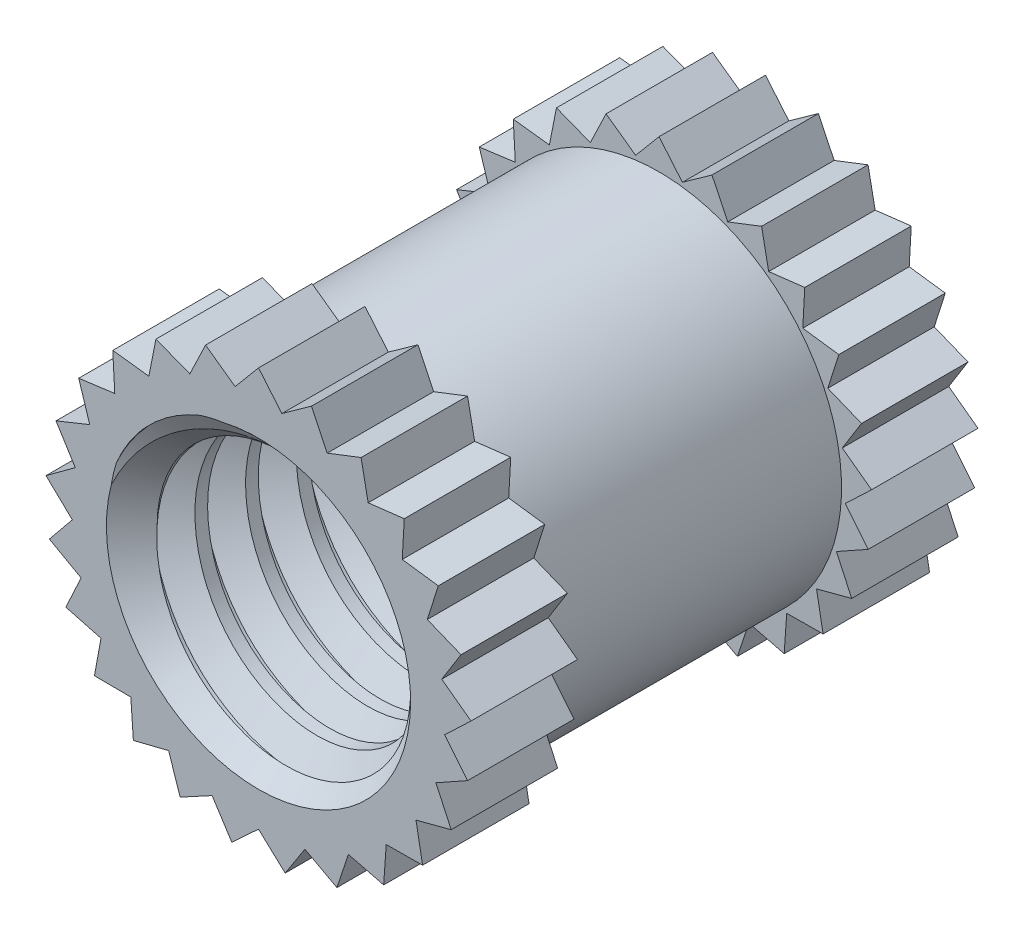
from build123d import *

# Parameters (mm, degrees)
SKETCH1_R             = 1.8
BOSS_EXTRUDE1_DEPTH   = 2.5
THREAD1_PITCH         = 0.5
BOSS_EXTRUDE2_DEPTH   = 1.05
CIRPATTERN1_COUNT     = 25
MIRROR1_COPY_1_DEPTH  = 1.05
MIRROR1_COPY_2_DEPTH  = 1.05
MIRROR1_COPY_3_DEPTH  = 1.05
MIRROR1_COPY_4_DEPTH  = 1.05
MIRROR1_COPY_5_DEPTH  = 1.05
MIRROR1_COPY_6_DEPTH  = 1.05
MIRROR1_COPY_7_DEPTH  = 1.05
MIRROR1_COPY_8_DEPTH  = 1.05
MIRROR1_COPY_9_DEPTH  = 1.05
MIRROR1_COPY_10_DEPTH = 1.05
MIRROR1_COPY_11_DEPTH = 1.05
MIRROR1_COPY_12_DEPTH = 1.05
MIRROR1_COPY_13_DEPTH = 1.05
MIRROR1_COPY_14_DEPTH = 1.05
MIRROR1_COPY_15_DEPTH = 1.05
MIRROR1_COPY_16_DEPTH = 1.05
MIRROR1_COPY_17_DEPTH = 1.05
MIRROR1_COPY_18_DEPTH = 1.05
MIRROR1_COPY_19_DEPTH = 1.05
MIRROR1_COPY_20_DEPTH = 1.05
MIRROR1_COPY_21_DEPTH = 1.05
MIRROR1_COPY_22_DEPTH = 1.05
MIRROR1_COPY_23_DEPTH = 1.05
MIRROR1_COPY_24_DEPTH = 1.05


with BuildPart() as part:
    # Sketch1 → Boss-Extrude1 (new, symmetric)
    with BuildSketch(Plane.XY):
        Circle(SKETCH1_R)
    extrude(amount=BOSS_EXTRUDE1_DEPTH, both=True)

    # Sketch3 → Tap Drill for M3x0.5 Tap1 (revolve, cut)
    with BuildSketch(Plane(origin=(0, 0, 2.5), x_dir=(0, -1, 0), z_dir=(1, 0, 0))):
        Polygon((0, 0), (0, 5), (1.5, 5), (1.25, 4.75), (1.25, 0.25), (1.5, 0), align=None)
    revolve(axis=Axis((0, 0, 8.85), (0, 0, -1)), mode=Mode.SUBTRACT)

    # Thread1: the profile of Thread Profile1 profile screwed along a right-hand helix of 16 turns, 6 arcs to a turn; built about Z, then put on its axis
    thread1_z = Axis((0, 0, 0), (0, 0, 1))
    thread1_corners = [(1.2497, 0, -0.000173205), (1.520632937, 0, 0.156249999), (1.520632937, 0, 0.218749999), (1.2497, 0, 0.375173204)]
    with BuildLine(mode=Mode.PRIVATE) as thread1_profile:
        Line(thread1_corners[0], thread1_corners[1])
        Line(thread1_corners[1], thread1_corners[2])
        Line(thread1_corners[2], thread1_corners[3])
        Line(thread1_corners[3], thread1_corners[0])
    thread1_cap = Face(thread1_profile.wire())
    thread1_turn_angles = [0, 30, 60, 90, 120, 150, 180, 210, 240, 270, 300, 330, 360]
    thread1_turn_weights = [1, 0.8660254037844387, 1, 0.8660254037844387, 1, 0.8660254037844387, 1, 0.8660254037844387, 1, 0.8660254037844387, 1, 0.8660254037844387, 1]
    thread1_turn_rails = [Edge.make_bspline([Vector(p[0], p[1], 0).rotate(thread1_z, thread1_turn_angles[k]) / thread1_turn_weights[k] + Vector(0, 0, p[2] + THREAD1_PITCH * thread1_turn_angles[k] / 360) for k in range(13)], [0, 0, 0, 1, 1, 2, 2, 3, 3, 4, 4, 5, 5, 6, 6, 6], 2, thread1_turn_weights) for p in thread1_corners]
    thread1_turn_sides = [Face.make_surface_from_curves(thread1_turn_rails[p[0]], thread1_turn_rails[p[1]]) for p in [(0, 1), (1, 2), (2, 3), (3, 0)]]
    thread1 = Plane(origin=(0, 0, 3.25), x_dir=(-1, 0, 0), z_dir=(0, 0, -1)) * Solid(Shell([*[p.moved(Location((0, 0, THREAD1_PITCH * i))) for i in range(16) for p in thread1_turn_sides], thread1_cap, thread1_cap.rotate(thread1_z, 5760).moved(Location((0, 0, THREAD1_PITCH * 5760 / 360)))]))
    add(thread1, mode=Mode.SUBTRACT)

    # Sketch6 → Boss-Extrude2 (add)
    with BuildSketch(Plane.XY.offset(2.5)):
        with BuildLine():
            Line((0, 2.1), (-0.268646455, 1.779839623))
            ThreePointArc((-0.268646455, 1.779839623), (0, 1.8), (0.268646455, 1.779839623))
            Line((0.268646455, 1.779839623), (0, 2.1))
        make_face()
    boss_extrude2 = extrude(amount=-BOSS_EXTRUDE2_DEPTH)

    # CirPattern1: Boss-Extrude2 ×25 about axis
    cirpattern1_axis = Axis((0, 0, 0), (0, 0, 1))
    for i in range(1, CIRPATTERN1_COUNT):
        add(boss_extrude2.rotate(cirpattern1_axis, i * 360 / CIRPATTERN1_COUNT))

    # Mirror1: Boss-Extrude2 across plane
    add(boss_extrude2.mirror(Plane.XY))

    # Mirror1 copy 1 sketch → Mirror1 copy 1 (add)
    with BuildSketch(Plane(origin=(0, 0, -2.5), x_dir=(0.9685831611286311, 0.2486898871648548, 0), z_dir=(0, 0, -1))):
        with BuildLine():
            Line((0, -2.1), (-0.268646455, -1.779839623))
            ThreePointArc((-0.268646455, -1.779839623), (0, -1.8), (0.268646455, -1.779839623))
            Line((0.268646455, -1.779839623), (0, -2.1))
        make_face()
    extrude(amount=-MIRROR1_COPY_1_DEPTH)

    # Mirror1 copy 2 sketch → Mirror1 copy 2 (add)
    with BuildSketch(Plane(origin=(0, 0, -2.5), x_dir=(0.8763066800438636, 0.4817536741017153, 0), z_dir=(0, 0, -1))):
        with BuildLine():
            Line((0, -2.1), (-0.268646455, -1.779839623))
            ThreePointArc((-0.268646455, -1.779839623), (0, -1.8), (0.268646455, -1.779839623))
            Line((0.268646455, -1.779839623), (0, -2.1))
        make_face()
    extrude(amount=-MIRROR1_COPY_2_DEPTH)

    # Mirror1 copy 3 sketch → Mirror1 copy 3 (add)
    with BuildSketch(Plane(origin=(0, 0, -2.5), x_dir=(0.7289686274214116, 0.6845471059286887, 0), z_dir=(0, 0, -1))):
        with BuildLine():
            Line((0, -2.1), (-0.268646455, -1.779839623))
            ThreePointArc((-0.268646455, -1.779839623), (0, -1.8), (0.268646455, -1.779839623))
            Line((0.268646455, -1.779839623), (0, -2.1))
        make_face()
    extrude(amount=-MIRROR1_COPY_3_DEPTH)

    # Mirror1 copy 4 sketch → Mirror1 copy 4 (add)
    with BuildSketch(Plane(origin=(0, 0, -2.5), x_dir=(0.5358267949789965, 0.8443279255020151, 0), z_dir=(0, 0, -1))):
        with BuildLine():
            Line((0, -2.1), (-0.268646455, -1.779839623))
            ThreePointArc((-0.268646455, -1.779839623), (0, -1.8), (0.268646455, -1.779839623))
            Line((0.268646455, -1.779839623), (0, -2.1))
        make_face()
    extrude(amount=-MIRROR1_COPY_4_DEPTH)

    # Mirror1 copy 5 sketch → Mirror1 copy 5 (add)
    with BuildSketch(Plane(origin=(0, 0, -2.5), x_dir=(0.30901699437494745, 0.9510565162951535, 0), z_dir=(0, 0, -1))):
        with BuildLine():
            Line((0, -2.1), (-0.268646455, -1.779839623))
            ThreePointArc((-0.268646455, -1.779839623), (0, -1.8), (0.268646455, -1.779839623))
            Line((0.268646455, -1.779839623), (0, -2.1))
        make_face()
    extrude(amount=-MIRROR1_COPY_5_DEPTH)

    # Mirror1 copy 6 sketch → Mirror1 copy 6 (add)
    with BuildSketch(Plane(origin=(0, 0, -2.5), x_dir=(0.0627905195293133, 0.9980267284282716, 0), z_dir=(0, 0, -1))):
        with BuildLine():
            Line((0, -2.1), (-0.268646455, -1.779839623))
            ThreePointArc((-0.268646455, -1.779839623), (0, -1.8), (0.268646455, -1.779839623))
            Line((0.268646455, -1.779839623), (0, -2.1))
        make_face()
    extrude(amount=-MIRROR1_COPY_6_DEPTH)

    # Mirror1 copy 7 sketch → Mirror1 copy 7 (add)
    with BuildSketch(Plane(origin=(0, 0, -2.5), x_dir=(-0.1873813145857246, 0.9822872507286887, 0), z_dir=(0, 0, -1))):
        with BuildLine():
            Line((0, -2.1), (-0.268646455, -1.779839623))
            ThreePointArc((-0.268646455, -1.779839623), (0, -1.8), (0.268646455, -1.779839623))
            Line((0.268646455, -1.779839623), (0, -2.1))
        make_face()
    extrude(amount=-MIRROR1_COPY_7_DEPTH)

    # Mirror1 copy 8 sketch → Mirror1 copy 8 (add)
    with BuildSketch(Plane(origin=(0, 0, -2.5), x_dir=(-0.4257792915650727, 0.9048270524660195, 0), z_dir=(0, 0, -1))):
        with BuildLine():
            Line((0, -2.1), (-0.268646455, -1.779839623))
            ThreePointArc((-0.268646455, -1.779839623), (0, -1.8), (0.268646455, -1.779839623))
            Line((0.268646455, -1.779839623), (0, -2.1))
        make_face()
    extrude(amount=-MIRROR1_COPY_8_DEPTH)

    # Mirror1 copy 9 sketch → Mirror1 copy 9 (add)
    with BuildSketch(Plane(origin=(0, 0, -2.5), x_dir=(-0.6374239897486897, 0.7705132427757893, 0), z_dir=(0, 0, -1))):
        with BuildLine():
            Line((0, -2.1), (-0.268646455, -1.779839623))
            ThreePointArc((-0.268646455, -1.779839623), (0, -1.8), (0.268646455, -1.779839623))
            Line((0.268646455, -1.779839623), (0, -2.1))
        make_face()
    extrude(amount=-MIRROR1_COPY_9_DEPTH)

    # Mirror1 copy 10 sketch → Mirror1 copy 10 (add)
    with BuildSketch(Plane(origin=(0, 0, -2.5), x_dir=(-0.8090169943749473, 0.5877852522924732, 0), z_dir=(0, 0, -1))):
        with BuildLine():
            Line((0, -2.1), (-0.268646455, -1.779839623))
            ThreePointArc((-0.268646455, -1.779839623), (0, -1.8), (0.268646455, -1.779839623))
            Line((0.268646455, -1.779839623), (0, -2.1))
        make_face()
    extrude(amount=-MIRROR1_COPY_10_DEPTH)

    # Mirror1 copy 11 sketch → Mirror1 copy 11 (add)
    with BuildSketch(Plane(origin=(0, 0, -2.5), x_dir=(-0.9297764858882515, 0.36812455268467775, 0), z_dir=(0, 0, -1))):
        with BuildLine():
            Line((0, -2.1), (-0.268646455, -1.779839623))
            ThreePointArc((-0.268646455, -1.779839623), (0, -1.8), (0.268646455, -1.779839623))
            Line((0.268646455, -1.779839623), (0, -2.1))
        make_face()
    extrude(amount=-MIRROR1_COPY_11_DEPTH)

    # Mirror1 copy 12 sketch → Mirror1 copy 12 (add)
    with BuildSketch(Plane(origin=(0, 0, -2.5), x_dir=(-0.9921147013144779, 0.1253332335643041, 0), z_dir=(0, 0, -1))):
        with BuildLine():
            Line((0, -2.1), (-0.268646455, -1.779839623))
            ThreePointArc((-0.268646455, -1.779839623), (0, -1.8), (0.268646455, -1.779839623))
            Line((0.268646455, -1.779839623), (0, -2.1))
        make_face()
    extrude(amount=-MIRROR1_COPY_12_DEPTH)

    # Mirror1 copy 13 sketch → Mirror1 copy 13 (add)
    with BuildSketch(Plane(origin=(0, 0, -2.5), x_dir=(-0.9921147013144779, -0.12533323356430429, 0), z_dir=(0, 0, -1))):
        with BuildLine():
            Line((0, -2.1), (-0.268646455, -1.779839623))
            ThreePointArc((-0.268646455, -1.779839623), (0, -1.8), (0.268646455, -1.779839623))
            Line((0.268646455, -1.779839623), (0, -2.1))
        make_face()
    extrude(amount=-MIRROR1_COPY_13_DEPTH)

    # Mirror1 copy 14 sketch → Mirror1 copy 14 (add)
    with BuildSketch(Plane(origin=(0, 0, -2.5), x_dir=(-0.9297764858882515, -0.3681245526846779, 0), z_dir=(0, 0, -1))):
        with BuildLine():
            Line((0, -2.1), (-0.268646455, -1.779839623))
            ThreePointArc((-0.268646455, -1.779839623), (0, -1.8), (0.268646455, -1.779839623))
            Line((0.268646455, -1.779839623), (0, -2.1))
        make_face()
    extrude(amount=-MIRROR1_COPY_14_DEPTH)

    # Mirror1 copy 15 sketch → Mirror1 copy 15 (add)
    with BuildSketch(Plane(origin=(0, 0, -2.5), x_dir=(-0.8090169943749476, -0.587785252292473, 0), z_dir=(0, 0, -1))):
        with BuildLine():
            Line((0, -2.1), (-0.268646455, -1.779839623))
            ThreePointArc((-0.268646455, -1.779839623), (0, -1.8), (0.268646455, -1.779839623))
            Line((0.268646455, -1.779839623), (0, -2.1))
        make_face()
    extrude(amount=-MIRROR1_COPY_15_DEPTH)

    # Mirror1 copy 16 sketch → Mirror1 copy 16 (add)
    with BuildSketch(Plane(origin=(0, 0, -2.5), x_dir=(-0.6374239897486895, -0.7705132427757894, 0), z_dir=(0, 0, -1))):
        with BuildLine():
            Line((0, -2.1), (-0.268646455, -1.779839623))
            ThreePointArc((-0.268646455, -1.779839623), (0, -1.8), (0.268646455, -1.779839623))
            Line((0.268646455, -1.779839623), (0, -2.1))
        make_face()
    extrude(amount=-MIRROR1_COPY_16_DEPTH)

    # Mirror1 copy 17 sketch → Mirror1 copy 17 (add)
    with BuildSketch(Plane(origin=(0, 0, -2.5), x_dir=(-0.42577929156507216, -0.9048270524660198, 0), z_dir=(0, 0, -1))):
        with BuildLine():
            Line((0, -2.1), (-0.268646455, -1.779839623))
            ThreePointArc((-0.268646455, -1.779839623), (0, -1.8), (0.268646455, -1.779839623))
            Line((0.268646455, -1.779839623), (0, -2.1))
        make_face()
    extrude(amount=-MIRROR1_COPY_17_DEPTH)

    # Mirror1 copy 18 sketch → Mirror1 copy 18 (add)
    with BuildSketch(Plane(origin=(0, 0, -2.5), x_dir=(-0.18738131458572463, -0.9822872507286887, 0), z_dir=(0, 0, -1))):
        with BuildLine():
            Line((0, -2.1), (-0.268646455, -1.779839623))
            ThreePointArc((-0.268646455, -1.779839623), (0, -1.8), (0.268646455, -1.779839623))
            Line((0.268646455, -1.779839623), (0, -2.1))
        make_face()
    extrude(amount=-MIRROR1_COPY_18_DEPTH)

    # Mirror1 copy 19 sketch → Mirror1 copy 19 (add)
    with BuildSketch(Plane(origin=(0, 0, -2.5), x_dir=(0.06279051952931372, -0.9980267284282716, 0), z_dir=(0, 0, -1))):
        with BuildLine():
            Line((0, -2.1), (-0.268646455, -1.779839623))
            ThreePointArc((-0.268646455, -1.779839623), (0, -1.8), (0.268646455, -1.779839623))
            Line((0.268646455, -1.779839623), (0, -2.1))
        make_face()
    extrude(amount=-MIRROR1_COPY_19_DEPTH)

    # Mirror1 copy 20 sketch → Mirror1 copy 20 (add)
    with BuildSketch(Plane(origin=(0, 0, -2.5), x_dir=(0.30901699437494723, -0.9510565162951536, 0), z_dir=(0, 0, -1))):
        with BuildLine():
            Line((0, -2.1), (-0.268646455, -1.779839623))
            ThreePointArc((-0.268646455, -1.779839623), (0, -1.8), (0.268646455, -1.779839623))
            Line((0.268646455, -1.779839623), (0, -2.1))
        make_face()
    extrude(amount=-MIRROR1_COPY_20_DEPTH)

    # Mirror1 copy 21 sketch → Mirror1 copy 21 (add)
    with BuildSketch(Plane(origin=(0, 0, -2.5), x_dir=(0.5358267949789968, -0.844327925502015, 0), z_dir=(0, 0, -1))):
        with BuildLine():
            Line((0, -2.1), (-0.268646455, -1.779839623))
            ThreePointArc((-0.268646455, -1.779839623), (0, -1.8), (0.268646455, -1.779839623))
            Line((0.268646455, -1.779839623), (0, -2.1))
        make_face()
    extrude(amount=-MIRROR1_COPY_21_DEPTH)

    # Mirror1 copy 22 sketch → Mirror1 copy 22 (add)
    with BuildSketch(Plane(origin=(0, 0, -2.5), x_dir=(0.7289686274214119, -0.6845471059286883, 0), z_dir=(0, 0, -1))):
        with BuildLine():
            Line((0, -2.1), (-0.268646455, -1.779839623))
            ThreePointArc((-0.268646455, -1.779839623), (0, -1.8), (0.268646455, -1.779839623))
            Line((0.268646455, -1.779839623), (0, -2.1))
        make_face()
    extrude(amount=-MIRROR1_COPY_22_DEPTH)

    # Mirror1 copy 23 sketch → Mirror1 copy 23 (add)
    with BuildSketch(Plane(origin=(0, 0, -2.5), x_dir=(0.8763066800438636, -0.4817536741017153, 0), z_dir=(0, 0, -1))):
        with BuildLine():
            Line((0, -2.1), (-0.268646455, -1.779839623))
            ThreePointArc((-0.268646455, -1.779839623), (0, -1.8), (0.268646455, -1.779839623))
            Line((0.268646455, -1.779839623), (0, -2.1))
        make_face()
    extrude(amount=-MIRROR1_COPY_23_DEPTH)

    # Mirror1 copy 24 sketch → Mirror1 copy 24 (add)
    with BuildSketch(Plane(origin=(0, 0, -2.5), x_dir=(0.9685831611286312, -0.2486898871648545, 0), z_dir=(0, 0, -1))):
        with BuildLine():
            Line((0, -2.1), (-0.268646455, -1.779839623))
            ThreePointArc((-0.268646455, -1.779839623), (0, -1.8), (0.268646455, -1.779839623))
            Line((0.268646455, -1.779839623), (0, -2.1))
        make_face()
    extrude(amount=-MIRROR1_COPY_24_DEPTH)


solid = part.part
